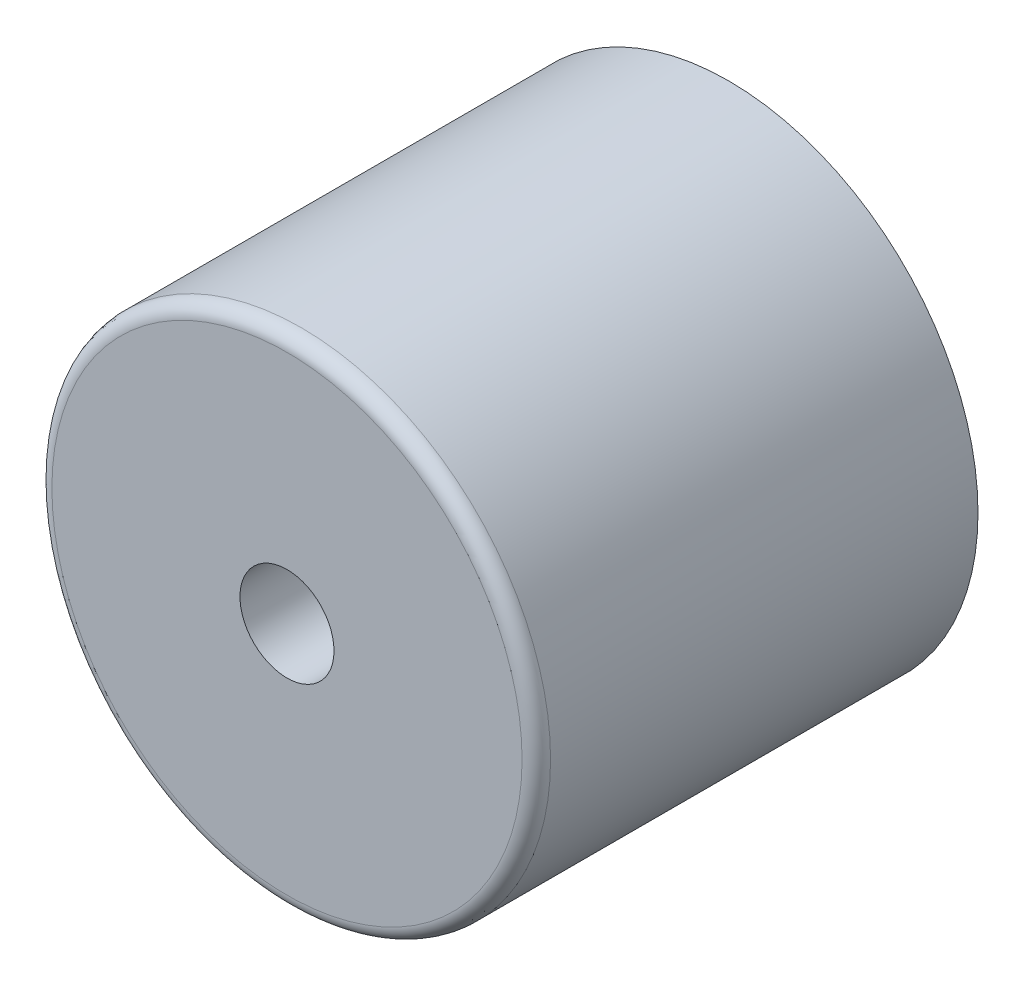
from build123d import *

# Parameters (mm, degrees)
SCHIZZO1_R                   = 17.5
ESTRUSIONE_ESTRUSIONE1_DEPTH = 31
RACCORDO1_R                  = 1
SCHIZZO2_R                   = 14.25
TAGLIO_ESTRUSIONE1_DEPTH     = 14
TAGLIO_ESTRUSIONE2_START     = -4.7
SCHIZZO5_R                   = 0.25
TAGLIO_ESTRUSIONE2_DEPTH     = 4.7
FORO_PER_VITE_M6_1_D         = 6.6


with BuildPart() as part:
    # Schizzo1 → Estrusione-Estrusione1 (new body)
    with BuildSketch(Plane.XY):
        Circle(SCHIZZO1_R)
    extrude(amount=ESTRUSIONE_ESTRUSIONE1_DEPTH)

    # Raccordo1
    raccordo1_edges = [part.edges().sort_by_distance(p)[0] for p in [
        (-17.5, 0, 31),
    ]]
    fillet(raccordo1_edges, radius=RACCORDO1_R)

    # Schizzo2 → Taglio-Estrusione1 (cut)
    with BuildSketch(Plane(origin=(0, 0, 0), x_dir=(-1, 0, 0), z_dir=(0, 0, -1))):
        Circle(SCHIZZO2_R)
    extrude(amount=-TAGLIO_ESTRUSIONE1_DEPTH, mode=Mode.SUBTRACT)

    # Schizzo3 → Taglia-Rivoluzione1 (revolve, cut)
    with BuildSketch(Plane(origin=(0, 0, 0), x_dir=(1, 0, 0), z_dir=(0, 1, 0))):
        Polygon((16, 0), (14.25, 0), (14.25, -6), align=None)
    revolve(axis=Axis((0, 0, 0), (0, 0, 1)), mode=Mode.SUBTRACT)

    # Schizzo4 → Taglia-Rivoluzione2 (revolve, cut)
    with BuildSketch(Plane(origin=(0, 0, 0), x_dir=(1, 0, 0), z_dir=(0, 1, 0))):
        Polygon((9.25, -14), (0.25, -14), (0.25, -18.7), align=None)
    revolve(axis=Axis((0, 0, 14), (0, 0, 1)), mode=Mode.SUBTRACT)

    # Schizzo5 → Taglio-Estrusione2 (cut)
    with BuildSketch(Plane(origin=(0, 0, 14), x_dir=(-1, 0, 0), z_dir=(0, 0, -1)).offset(TAGLIO_ESTRUSIONE2_START)):
        Circle(SCHIZZO5_R)
    extrude(amount=TAGLIO_ESTRUSIONE2_DEPTH, mode=Mode.SUBTRACT)

    # Foro per Vite M6-1 (through all)
    with Locations(Plane.XY.offset(31)):
        with Locations((0, 0)):
            Hole(FORO_PER_VITE_M6_1_D / 2)


solid = part.part
